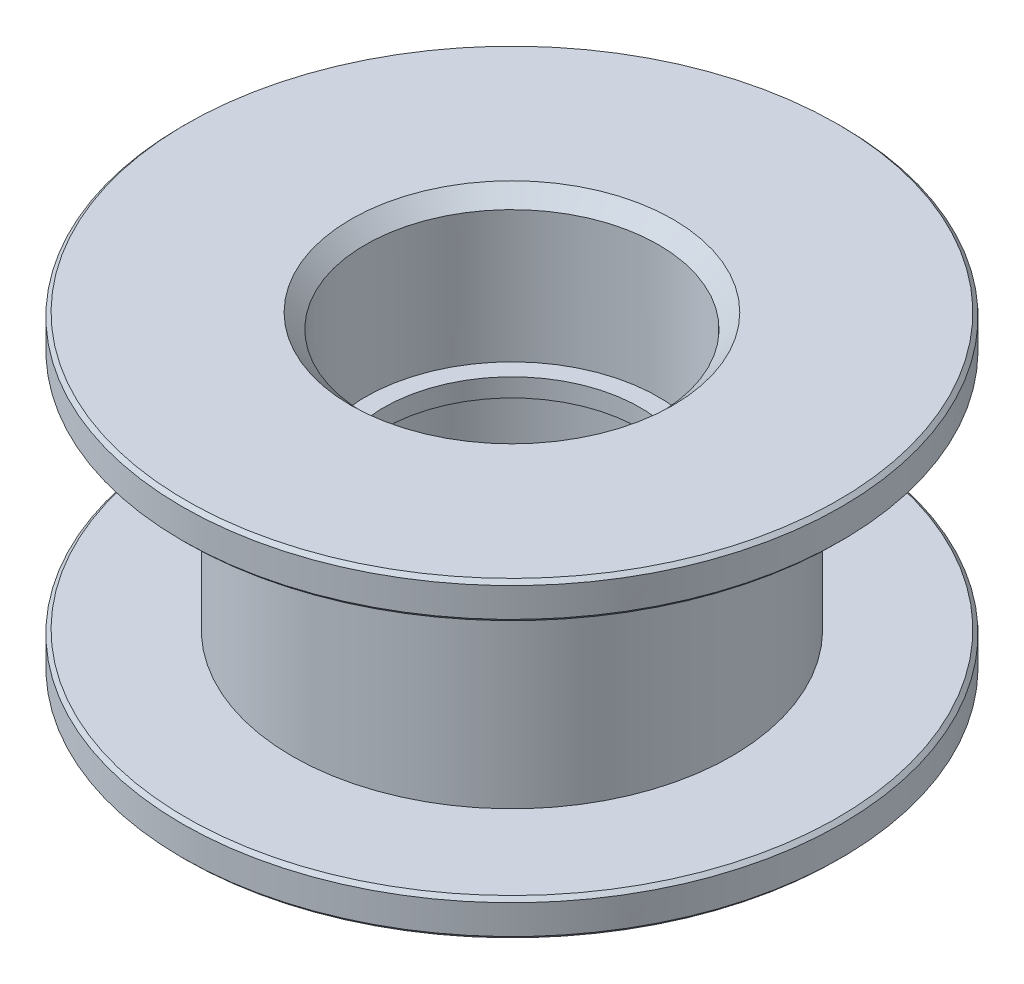
from build123d import *

# Parameters (mm, degrees)
INNERC_SIZE = 0.4
OUTERC_SIZE = 0.1


with BuildPart() as part:
    # BodyS → Body (revolve)
    with BuildSketch(Plane.XY):
        Polygon((6, -3.25), (6, 3.25), (9, 3.25), (9, 4.25), (4, 4.25), (4, 0.25), (3.5, 0.25), (3.5, -0.25), (4, -0.25), (4, -4.25), (9, -4.25), (9, -3.25), align=None)
    revolve(axis=Axis((0, 4.25, 0), (0, -1, 0)))

    # InnerC
    innerc_edges = [part.edges().sort_by_distance(p)[0] for p in [
        (-4, -4.25, 0),
        (-4, 4.25, 0),
    ]]
    chamfer(innerc_edges, length=INNERC_SIZE)

    # OuterC
    outerc_edges = [part.edges().sort_by_distance(p)[0] for p in [
        (-9, -4.25, 0),
        (-9, -3.25, 0),
        (-9, 3.25, 0),
        (-9, 4.25, 0),
    ]]
    chamfer(outerc_edges, length=OUTERC_SIZE)


solid = part.part
